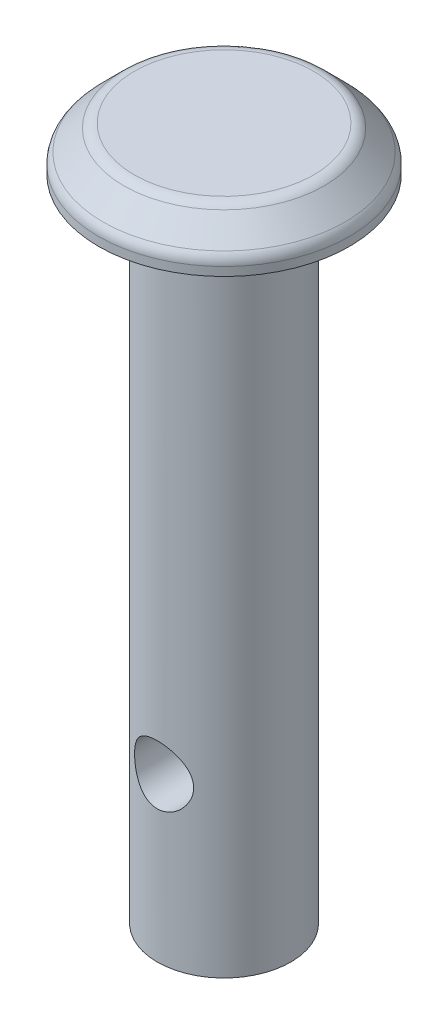
from build123d import *

# Parameters (mm, degrees)
SKETCH1_R               = 2.265
BOSS_EXTRUDE1_DEPTH     = 22
SKETCH2_R               = 4.25
BOSS_EXTRUDE2_DEPTH     = 1.5
CHAMFER1_SIZE           = 1
FILLET1_R               = 0.5
CUT_EXTRUDE1_DEPTH      = 25.256442478
CUT_EXTRUDE1_DEPTH_BACK = 25.256442478
SKETCH3_R               = 1


with BuildPart() as part:
    # Sketch1 → Boss-Extrude1 (new body)
    with BuildSketch(Plane(origin=(0, 0, 0), x_dir=(1, 0, 0), z_dir=(0, 1, 0))):
        Circle(SKETCH1_R)
    extrude(amount=BOSS_EXTRUDE1_DEPTH)

    # Sketch2 → Boss-Extrude2 (add)
    with BuildSketch(Plane(origin=(0, 22, 0), x_dir=(1, 0, 0), z_dir=(0, 1, 0))):
        Circle(SKETCH2_R)
    extrude(amount=BOSS_EXTRUDE2_DEPTH)

    # Chamfer1
    chamfer1_edges = [part.edges().sort_by_distance(p)[0] for p in [
        (-4.25, 23.5, 0),
    ]]
    chamfer(chamfer1_edges, length=CHAMFER1_SIZE)

    # Fillet1
    fillet1_edges = [part.edges().sort_by_distance(p)[0] for p in [
        (-4.25, 22.5, 0),
        (-3.25, 23.5, 0),
    ]]
    fillet(fillet1_edges, radius=FILLET1_R)

    # Sketch3 → Cut-Extrude1 (cut, two sides: drawn at the far end of the back side and taken through both)
    with BuildSketch(Plane.XY.offset(-CUT_EXTRUDE1_DEPTH_BACK)):
        with Locations((0, 5.5)):
            Circle(SKETCH3_R)
    extrude(amount=CUT_EXTRUDE1_DEPTH + CUT_EXTRUDE1_DEPTH_BACK, mode=Mode.SUBTRACT)


solid = part.part
